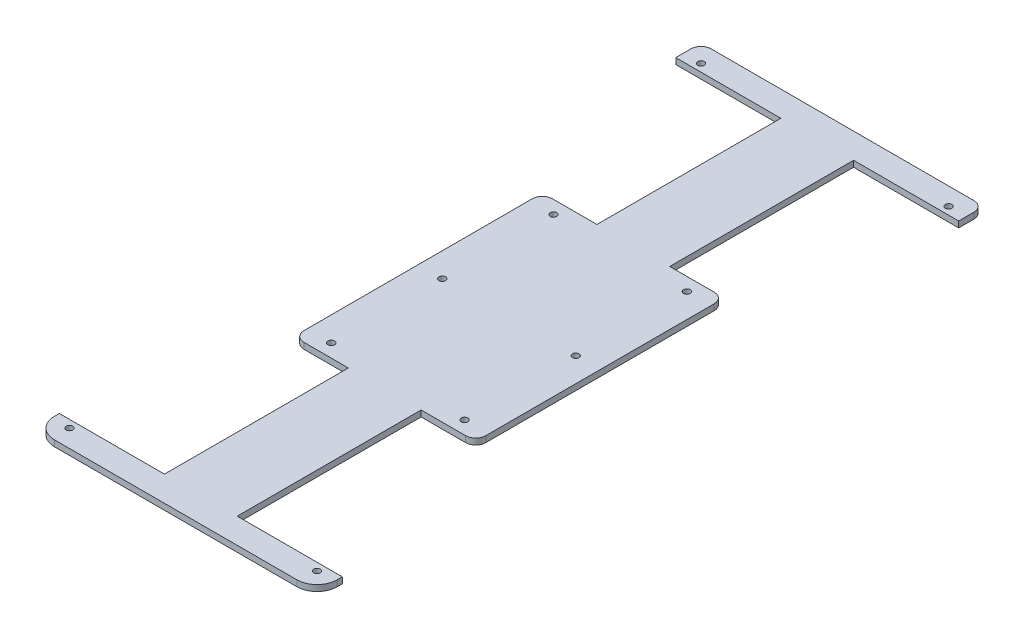
from build123d import *

# Parameters (mm, degrees)
BOSS_EXTRUDE1_DEPTH = 3
FILLET1_R           = 10
FILLET2_R           = 5
SKETCH2_R           = 1.65
CUT_EXTRUDE1_DEPTH  = 359.481519747
SKETCH3_R           = 1.65
CUT_EXTRUDE2_DEPTH  = 359.481519747
SKETCH4_R           = 1.65
CUT_EXTRUDE3_DEPTH  = 359.481519747


with BuildPart() as part:
    # Sketch1 → Boss-Extrude1 (new body)
    with BuildSketch(Plane(origin=(0, 0, 0), x_dir=(1, 0, 0), z_dir=(0, 1, 0))):
        Polygon((0, 0), (140, 0), (140, 12.5), (88, 12.5), (88, 103.5), (115, 103.5), (115, 226.5), (88, 226.5), (88, 317.5), (140, 317.5), (140, 330), (0, 330), (0, 317.5), (52, 317.5), (52, 226.5), (25, 226.5), (25, 103.5), (52, 103.5), (52, 12.5), (0, 12.5), align=None)
    extrude(amount=BOSS_EXTRUDE1_DEPTH)

    # Fillet1
    fillet1_edges = [part.edges().sort_by_distance(p)[0] for p in [
        (140, 1.5, 0),
        (0, 1.5, 0),
    ]]
    fillet(fillet1_edges, radius=FILLET1_R)

    # Fillet2
    fillet2_edges = [part.edges().sort_by_distance(p)[0] for p in [
        (0, 1.5, -330),
        (140, 1.5, -330),
        (115, 1.5, -226.5),
        (115, 1.5, -103.5),
        (25, 1.5, -103.5),
        (25, 1.5, -226.5),
    ]]
    fillet(fillet2_edges, radius=FILLET2_R)

    # Sketch2 → Cut-Extrude1 (cut, through all)
    with BuildSketch(Plane(origin=(0, 3, 0), x_dir=(1, 0, 0), z_dir=(0, 1, 0))):
        with Locations((37, 220)):
            Circle(SKETCH2_R)
        with Locations((37, 165)):
            Circle(SKETCH2_R)
        with Locations((37, 110)):
            Circle(SKETCH2_R)
        with Locations((103, 110)):
            Circle(SKETCH2_R)
        with Locations((103, 165)):
            Circle(SKETCH2_R)
        with Locations((103, 220)):
            Circle(SKETCH2_R)
    extrude(amount=-CUT_EXTRUDE1_DEPTH, mode=Mode.SUBTRACT)

    # Sketch3 → Cut-Extrude2 (cut, through all)
    with BuildSketch(Plane(origin=(0, 3, 0), x_dir=(1, 0, 0), z_dir=(0, 1, 0))):
        with Locations((8.75, 8.75)):
            Circle(SKETCH3_R)
        with Locations((131.25, 8.75)):
            Circle(SKETCH3_R)
    extrude(amount=-CUT_EXTRUDE2_DEPTH, mode=Mode.SUBTRACT)

    # Sketch4 → Cut-Extrude3 (cut, through all)
    with BuildSketch(Plane(origin=(0, 3, 0), x_dir=(1, 0, 0), z_dir=(0, 1, 0))):
        with Locations((8.75, 321.25)):
            Circle(SKETCH4_R)
        with Locations((131.25, 321.25)):
            Circle(SKETCH4_R)
    extrude(amount=-CUT_EXTRUDE3_DEPTH, mode=Mode.SUBTRACT)


solid = part.part
